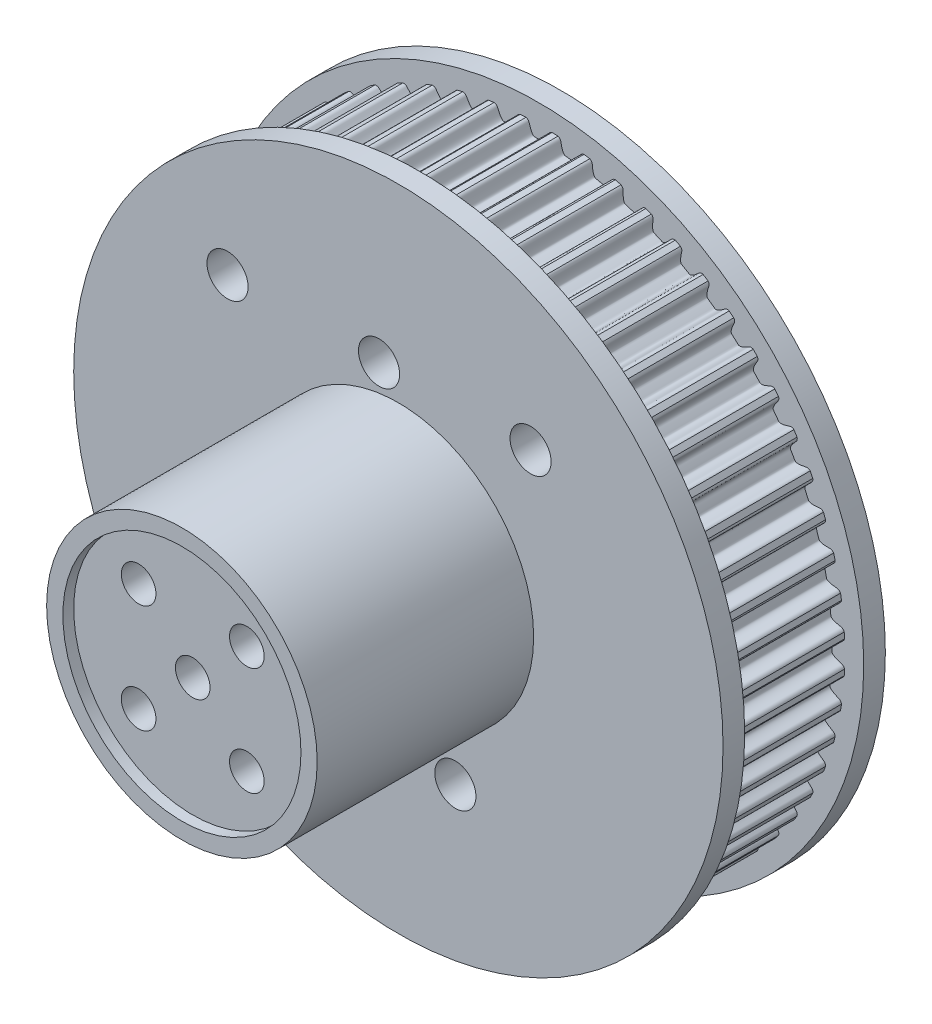
from build123d import *

# Parameters (mm, degrees)
TOOTHEXTRUDECUTGEARBELT01_DEPTH = 8.249999876
TOOTH_PATTERN_60_COUNT          = 60
BOREREVOLVESKETCH_W             = 19.547999706
BOREREVOLVESKETCH_H             = 5
SKETCH_5_R                      = 34.431410785
CUT_EXTRUDE_2_DEPTH             = 4.55
SKETCH_6_R                      = 32.21260367
CUT_EXTRUDE_3_DEPTH             = 4
SKETCH_7_R                      = 30
EXTRUDE_2_DEPTH                 = 2
EXTRUDE_START                   = 2
SKETCH_8_R                      = 30
EXTRUDE_3_DEPTH                 = 2
SKETCH_9_R                      = 19.144097689
EXTRUDE_4_DEPTH                 = 14
SKETCH_10_R                     = 12.5
EXTRUDE_6_DEPTH                 = 20
SKETCH_12_R                     = 1.6
CUT_EXTRUDE_4_DEPTH             = 55.998727217
SKETCH_13_R                     = 11
CUT_EXTRUDE_5_DEPTH             = 1
CUT_EXTRUDE_6_REACH             = 56.999
SKETCH_14_R                     = 1.9
SKETCH_15_R                     = 3.5
SKETCH_15_R_2                   = 3
CUT_EXTRUDE_7_DEPTH             = 20


with BuildPart() as part:
    # SketchRevolveGearBelt01 → Gates_PowerGrip_GT_3mm, 15mm Belt Width (revolve)
    with BuildSketch(Plane(origin=(0, 0, 0), x_dir=(0, 0, -1), z_dir=(1, 0, 0))):
        Polygon((9.773999853, 0), (9.773999853, 26.247889362), (9.011999865, 26.247889362), (9.011999865, 28.496318105), (9.480047286, 29.626284536), (8.776051092, 29.917889307), (8.249999876, 28.647889326), (8.249999876, 28.252919332), (-8.249999876, 28.252919332), (-8.249999876, 28.647889326), (-8.776051092, 29.917889307), (-9.480047286, 29.626284536), (-9.011999865, 28.496318105), (-9.011999865, 26.247889362), (-9.773999853, 26.247889362), (-9.773999853, 0), align=None)
    revolve(axis=Axis((0, 0, 0), (0, 0, -1)))

    # SketchToothGearBelt01 → ToothExtrudeCutGearBelt01 (cut, symmetric)
    with BuildSketch(Plane.XY):
        with BuildLine():
            ThreePointArc((28.236700974, 1.291128894), (28.266204126, 0), (28.236700974, -1.291128894))
            add(Edge.make_bspline(
                [(28.236700974, -1.291128894), (28.23639652, -1.265464926), (28.232210766, -1.227015858), (28.21936503, -1.177256927), (28.206189468, -1.141036186), (28.189594076, -1.106249243), (28.169732628, -1.073217977), (28.146788814, -1.042248472), (28.120975422, -1.013626108), (28.092529847, -0.987620561), (28.061721096, -0.964454821), (28.02881301, -0.944409427), (27.994189766, -0.927423169), (27.930800257, -0.904994578), (27.850847297, -0.880874674), (27.757056447, -0.851218147), (27.678383147, -0.824734225), (27.60446405, -0.798276401), (27.535308166, -0.771815981), (27.47091166, -0.74536021), (27.411273388, -0.71890735), (27.356390943, -0.692457579), (27.306261464, -0.666010094), (27.260881208, -0.639563429), (27.220245637, -0.613114736), (27.18434901, -0.586658928), (27.153186375, -0.560187301), (27.126750399, -0.533685798), (27.105050767, -0.507133275), (27.088069704, -0.480502635), (27.075940954, -0.453766913), (27.068379848, -0.426922601), (27.065077998, -0.375466934), (27.069851374, -0.299989788), (27.070067455, -0.19995905), (27.071220248, -0.099984782), (27.071391355, 0), (27.071220248, 0.099984782), (27.070067455, 0.19995905), (27.069851374, 0.299989788), (27.065077998, 0.375466934), (27.068379848, 0.426922601), (27.075940954, 0.453766913), (27.088069704, 0.480502635), (27.105050767, 0.507133275), (27.126750399, 0.533685798), (27.153186375, 0.560187301), (27.18434901, 0.586658928), (27.220245637, 0.613114736), (27.260881208, 0.639563429), (27.306261464, 0.666010094), (27.356390943, 0.692457579), (27.411273388, 0.71890735), (27.47091166, 0.74536021), (27.535308166, 0.771815981), (27.60446405, 0.798276401), (27.678383147, 0.824734225), (27.757056447, 0.851218147), (27.850847297, 0.880874674), (27.930800257, 0.904994578), (27.994189766, 0.927423169), (28.02881301, 0.944409427), (28.061721096, 0.964454821), (28.092529847, 0.987620561), (28.120975422, 1.013626108), (28.146788814, 1.042248472), (28.169732628, 1.073217977), (28.189594076, 1.106249243), (28.206189468, 1.141036186), (28.21936503, 1.177256927), (28.232210766, 1.227015858), (28.23639652, 1.265464926), (28.236700974, 1.291128894)],
                knots=[0, 0, 0, 0, 0.019512813, 0.029269219, 0.039025625, 0.048782032, 0.058538438, 0.068294844, 0.078051251, 0.087807657, 0.097564064, 0.10732047, 0.117076876, 0.126833283, 0.158411348, 0.180601822, 0.201643681, 0.221544022, 0.240311236, 0.257955332, 0.274488358, 0.289924961, 0.304283149, 0.317585307, 0.329859599, 0.341141892, 0.351478382, 0.360929145, 0.369572747, 0.377511751, 0.384878211, 0.391836853, 0.398582347, 0.423955538, 0.449303692, 0.474651846, 0.5, 0.525348154, 0.550696308, 0.576044462, 0.601417653, 0.608163147, 0.615121789, 0.622488249, 0.630427253, 0.639070855, 0.648521618, 0.658858108, 0.670140401, 0.682414693, 0.695716851, 0.710075039, 0.725511642, 0.742044668, 0.759688764, 0.778455978, 0.798356319, 0.819398178, 0.841588652, 0.873166717, 0.882923124, 0.89267953, 0.902435936, 0.912192343, 0.921948749, 0.931705156, 0.941461562, 0.951217968, 0.960974375, 0.970730781, 0.980487187, 1, 1, 1, 1], degree=3))
        make_face()
    toothextrudecutgearbelt01 = extrude(amount=TOOTHEXTRUDECUTGEARBELT01_DEPTH, both=True, mode=Mode.SUBTRACT)

    # Tooth Pattern, 60: ToothExtrudeCutGearBelt01 ×60 about axis
    tooth_pattern_60_axis = Axis((0, 0, 55), (0, 0, -1))
    for i in range(1, TOOTH_PATTERN_60_COUNT):
        add(toothextrudecutgearbelt01.rotate(tooth_pattern_60_axis, i * 360 / TOOTH_PATTERN_60_COUNT), mode=Mode.SUBTRACT)

    # BoreRevolveSketch → BoreRevolveCut (revolve, cut)
    with BuildSketch(Plane(origin=(0, 0, 0), x_dir=(0, 0, -1), z_dir=(1, 0, 0))):
        with Locations((0, 2.5)):
            Rectangle(BOREREVOLVESKETCH_W, BOREREVOLVESKETCH_H)
    revolve(axis=Axis((0, 0, 0), (0, 0, -1)), mode=Mode.SUBTRACT)

    # 草图5 → 切除-拉伸2 (cut)
    with BuildSketch(Plane.XY.offset(9.773999853)):
        Circle(SKETCH_5_R)
    extrude(amount=-CUT_EXTRUDE_2_DEPTH, mode=Mode.SUBTRACT)

    # 草图6 → 切除-拉伸3 (cut)
    with BuildSketch(Plane(origin=(0, 0, -9.773999853), x_dir=(-1, 0, 0), z_dir=(0, 0, -1))):
        Circle(SKETCH_6_R)
    extrude(amount=-CUT_EXTRUDE_3_DEPTH, mode=Mode.SUBTRACT)

    # 草图7 → 凸台-拉伸2 (add)
    with BuildSketch(Plane.XY.offset(5.223999853)):
        Circle(SKETCH_7_R)
    extrude(amount=EXTRUDE_2_DEPTH)

    # 草图8 → 凸台-拉伸3 (add)
    with BuildSketch(Plane(origin=(0, 0, -5.773999853), x_dir=(-1, 0, 0), z_dir=(0, 0, -1)).offset(EXTRUDE_START)):
        Circle(SKETCH_8_R)
    extrude(amount=-EXTRUDE_3_DEPTH)

    # 草图9 → 凸台-拉伸4 (add)
    with BuildSketch(Plane.XY.offset(7.223999853)):
        Circle(SKETCH_9_R)
    extrude(amount=-EXTRUDE_4_DEPTH)

    # 草图10 → 凸台-拉伸6 (add)
    with BuildSketch(Plane.XY.offset(7.223999853)):
        Circle(SKETCH_10_R)
    extrude(amount=EXTRUDE_6_DEPTH)

    # 草图12 → 切除-拉伸4 (cut, through all)
    with BuildSketch(Plane.XY.offset(27.223999853)):
        Circle(SKETCH_12_R)
        with Locations((-5, 5)):
            Circle(SKETCH_12_R)
        with Locations((5, 5)):
            Circle(SKETCH_12_R)
        with Locations((5, -5)):
            Circle(SKETCH_12_R)
        with Locations((-5, -5)):
            Circle(SKETCH_12_R)
    extrude(amount=-CUT_EXTRUDE_4_DEPTH, mode=Mode.SUBTRACT)

    # 草图13 → 切除-拉伸5 (cut)
    with BuildSketch(Plane.XY.offset(27.223999853)):
        Circle(SKETCH_13_R)
    extrude(amount=-CUT_EXTRUDE_5_DEPTH, mode=Mode.SUBTRACT)

    # 草图14 → 切除-拉伸6 (cut, up to next)
    with BuildSketch(Plane(origin=(0, 0, -7.773999853), x_dir=(-1, 0, 0), z_dir=(0, 0, -1)), mode=Mode.PRIVATE) as cut_extrude_6_sk1:
        with Locations((15.784545254, 14.818909588)):
            Circle(SKETCH_14_R)
    cut_extrude_6_tool1 = extrude(cut_extrude_6_sk1.sketch, amount=-CUT_EXTRUDE_6_REACH, mode=Mode.PRIVATE) & part.part
    # 草图14 → 切除-拉伸6 (cut, up to next)
    with BuildSketch(Plane(origin=(0, 0, -7.773999853), x_dir=(-1, 0, 0), z_dir=(0, 0, -1)), mode=Mode.PRIVATE) as cut_extrude_6_sk2:
        with Locations((1.784545254, 14.818909587)):
            Circle(SKETCH_14_R)
    cut_extrude_6_tool2 = extrude(cut_extrude_6_sk2.sketch, amount=-CUT_EXTRUDE_6_REACH, mode=Mode.PRIVATE) & part.part
    # 草图14 → 切除-拉伸6 (cut, up to next)
    with BuildSketch(Plane(origin=(0, 0, -7.773999853), x_dir=(-1, 0, 0), z_dir=(0, 0, -1)), mode=Mode.PRIVATE) as cut_extrude_6_sk3:
        with Locations((-12.215454746, 14.818909587)):
            Circle(SKETCH_14_R)
    cut_extrude_6_tool3 = extrude(cut_extrude_6_sk3.sketch, amount=-CUT_EXTRUDE_6_REACH, mode=Mode.PRIVATE) & part.part
    # 草图14 → 切除-拉伸6 (cut, up to next)
    with BuildSketch(Plane(origin=(0, 0, -7.773999853), x_dir=(-1, 0, 0), z_dir=(0, 0, -1)), mode=Mode.PRIVATE) as cut_extrude_6_sk4:
        with Locations((-5.265454745, -15.431090413)):
            Circle(SKETCH_14_R)
    cut_extrude_6_tool4 = extrude(cut_extrude_6_sk4.sketch, amount=-CUT_EXTRUDE_6_REACH, mode=Mode.PRIVATE) & part.part
    # 草图14 → 切除-拉伸6 (cut, up to next)
    with BuildSketch(Plane(origin=(0, 0, -7.773999853), x_dir=(-1, 0, 0), z_dir=(0, 0, -1)), mode=Mode.PRIVATE) as cut_extrude_6_sk5:
        with Locations((8.734545255, -15.431090413)):
            Circle(SKETCH_14_R)
    cut_extrude_6_tool5 = extrude(cut_extrude_6_sk5.sketch, amount=-CUT_EXTRUDE_6_REACH, mode=Mode.PRIVATE) & part.part
    add(cut_extrude_6_tool1.solids().sort_by_distance((-15.784545, 14.81891, -7.774))[0], mode=Mode.SUBTRACT)
    add(cut_extrude_6_tool2.solids().sort_by_distance((-1.784545, 14.81891, -7.774))[0], mode=Mode.SUBTRACT)
    add(cut_extrude_6_tool3.solids().sort_by_distance((12.215455, 14.81891, -7.774))[0], mode=Mode.SUBTRACT)
    add(cut_extrude_6_tool4.solids().sort_by_distance((5.265455, -15.43109, -7.774))[0], mode=Mode.SUBTRACT)
    add(cut_extrude_6_tool5.solids().sort_by_distance((-8.734545, -15.43109, -7.774))[0], mode=Mode.SUBTRACT)

    # 草图15 → 切除-拉伸7 (cut)
    with BuildSketch(Plane(origin=(0, 0, -7.773999853), x_dir=(-1, 0, 0), z_dir=(0, 0, -1))):
        Circle(SKETCH_15_R)
        with Locations((-5, 5)):
            Circle(SKETCH_15_R_2)
        with Locations((5, 5)):
            Circle(SKETCH_15_R_2)
        with Locations((5, -5)):
            Circle(SKETCH_15_R_2)
        with Locations((-5, -5)):
            Circle(SKETCH_15_R_2)
    extrude(amount=-CUT_EXTRUDE_7_DEPTH, mode=Mode.SUBTRACT)


solid = part.part
